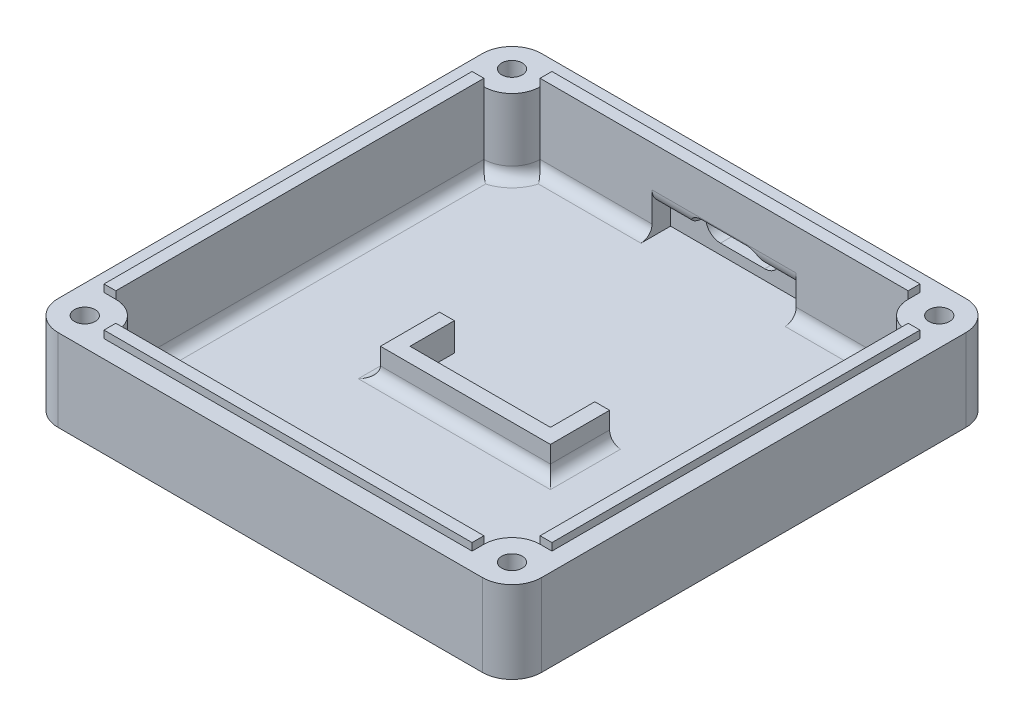
from build123d import *

# Parameters (mm, degrees)
SKETCH1_W           = 65.4
SKETCH1_H           = 65.4
BOSS_EXTRUDE1_DEPTH = 1.12
FILLET1_R           = 4
BOSS_EXTRUDE2_START = 10
BOSS_EXTRUDE2_DEPTH = 10
CUT_EXTRUDE1_REACH  = 75.96
SKETCH4_W           = 19.5
SKETCH4_H           = 3.5
CUT_EXTRUDE2_DEPTH  = 2.5
FILLET3_R           = 2
SKETCH5_W           = 1.6
SKETCH5_H           = 49.8
SKETCH5_W_2         = 49.8
SKETCH5_H_2         = 1.6
BOSS_EXTRUDE3_DEPTH = 1
BOSS_EXTRUDE4_DEPTH = 3.8
SKETCH7_R           = 1.4
CUT_EXTRUDE3_DEPTH  = 11.12
SKETCH8_R           = 2.75
CUT_EXTRUDE4_DEPTH  = 4
FILLET4_R           = 1.5
FILLET5_R           = 1.5


with BuildPart() as part:
    # Sketch1 → Boss-Extrude1 (new body)
    with BuildSketch(Plane(origin=(0, 0, 0), x_dir=(1, 0, 0), z_dir=(0, 1, 0))):
        Rectangle(SKETCH1_W, SKETCH1_H)
    extrude(amount=BOSS_EXTRUDE1_DEPTH)

    # Fillet1
    fillet1_edges = [part.edges().sort_by_distance(p)[0] for p in [
        (32.7, 0.56, 32.7),
        (-32.7, 0.56, 32.7),
        (-32.7, 0.56, -32.7),
        (32.7, 0.56, -32.7),
    ]]
    fillet(fillet1_edges, radius=FILLET1_R)

    # Sketch2 → Boss-Extrude2 (add)
    with BuildSketch(Plane(origin=(0, 1.12, 0), x_dir=(1, 0, 0), z_dir=(0, 1, 0)).offset(BOSS_EXTRUDE2_START)):
        with BuildLine():
            Line((-32.7, 28.7), (-32.7, -28.7))
            ThreePointArc((-32.7, -28.7), (-31.528427125, -31.528427125), (-28.7, -32.7))
            Line((-28.7, -32.7), (28.7, -32.7))
            ThreePointArc((28.7, -32.7), (31.528427125, -31.528427125), (32.7, -28.7))
            Line((32.7, -28.7), (32.7, 28.7))
            ThreePointArc((32.7, 28.7), (31.528427125, 31.528427125), (28.7, 32.7))
            Line((28.7, 32.7), (-28.7, 32.7))
            ThreePointArc((-28.7, 32.7), (-31.528427125, 31.528427125), (-32.7, 28.7))
        make_face()
        with BuildLine():
            Line((24.9, 28.7), (-24.9, 28.7))
            ThreePointArc((-24.9, 28.7), (-26.012994231, 26.012994231), (-28.7, 24.9))
            Line((-28.7, 24.9), (-28.7, -24.9))
            ThreePointArc((-28.7, -24.9), (-26.012994231, -26.012994231), (-24.9, -28.7))
            Line((-24.9, -28.7), (24.9, -28.7))
            ThreePointArc((24.9, -28.7), (26.012994231, -26.012994231), (28.7, -24.9))
            Line((28.7, -24.9), (28.7, 24.9))
            ThreePointArc((28.7, 24.9), (26.012994231, 26.012994231), (24.9, 28.7))
        make_face(mode=Mode.SUBTRACT)
    extrude(amount=-BOSS_EXTRUDE2_DEPTH)

    # Sketch3 → Cut-Extrude1 (cut, up to next)
    with BuildSketch(Plane(origin=(0, 0, -32.7), x_dir=(-1, 0, 0), z_dir=(0, 0, -1)), mode=Mode.PRIVATE) as cut_extrude1_sk1:
        with BuildLine():
            Line((-3, 6.5), (3, 6.5))
            ThreePointArc((3, 6.5), (5, 4.5), (3, 2.5))
            Line((3, 2.5), (-3, 2.5))
            ThreePointArc((-3, 2.5), (-5, 4.5), (-3, 6.5))
        make_face()
    cut_extrude1_tool1 = extrude(cut_extrude1_sk1.sketch, amount=-CUT_EXTRUDE1_REACH, mode=Mode.PRIVATE) & part.part
    add(cut_extrude1_tool1.solids().sort_by_distance((0, 4.5, -32.7))[0], mode=Mode.SUBTRACT)

    # Sketch4 → Cut-Extrude2 (cut)
    with BuildSketch(Plane.XY.offset(-28.7)):
        with Locations((0, 2.87)):
            Rectangle(SKETCH4_W, SKETCH4_H)
    extrude(amount=-CUT_EXTRUDE2_DEPTH, mode=Mode.SUBTRACT)

    # Fillet3
    # the kernel refuses this fillet: 2 mm, written as the material it takes off along each edge
    with BuildSketch(Plane(origin=(-0.003603246, 4.62, -28.7), x_dir=(0, 1, 0), z_dir=(1, 0, 0)), Plane(origin=(-9.75, 4.62, -28.7), x_dir=(0, 1, 0), z_dir=(1, 0, 0))) as fillet3_piece_1:
        with BuildLine():
            CenterArc((FILLET3_R, -FILLET3_R), FILLET3_R, 90, 90)
            Line((0, -FILLET3_R), (0, 0))
            Line((0, 0), (FILLET3_R, 0))
        make_face()
    extrude(amount=9.753603246, mode=Mode.SUBTRACT)

    # Sketch5 → Boss-Extrude3 (add)
    with BuildSketch(Plane(origin=(0, 11.12, 0), x_dir=(1, 0, 0), z_dir=(0, 1, 0))):
        with Locations((-29.5, 0)):
            Rectangle(SKETCH5_W, SKETCH5_H)
        with Locations((0, -29.5)):
            Rectangle(SKETCH5_W_2, SKETCH5_H_2)
        with Locations((29.5, 0)):
            Rectangle(SKETCH5_W, SKETCH5_H)
        with Locations((0, 29.5)):
            Rectangle(SKETCH5_W_2, SKETCH5_H_2)
    extrude(amount=BOSS_EXTRUDE3_DEPTH)

    # Sketch6 → Boss-Extrude4 (add)
    with BuildSketch(Plane(origin=(0, 1.12, 0), x_dir=(1, 0, 0), z_dir=(0, 1, 0))):
        Polygon((-9.5, -4.3), (9.5, -4.3), (9.5, 1.7), (11.5, 1.7), (11.5, -6.3), (-11.5, -6.3), (-11.5, 1.7), (-9.5, 1.7), align=None)
    extrude(amount=BOSS_EXTRUDE4_DEPTH)

    # Sketch7 → Cut-Extrude3 (cut)
    with BuildSketch(Plane(origin=(0, 11.12, 0), x_dir=(1, 0, 0), z_dir=(0, 1, 0))):
        with Locations(Location((-28.9, 28.9, 0), (0, 0, 270))):
            Circle(SKETCH7_R)
        with Locations(Location((28.9, 28.9, 0), (0, 0, 270))):
            Circle(SKETCH7_R)
        with Locations(Location((28.9, -28.9, 0), (0, 0, 270))):
            Circle(SKETCH7_R)
        with Locations(Location((-28.9, -28.9, 0), (0, 0, 270))):
            Circle(SKETCH7_R)
    extrude(amount=-CUT_EXTRUDE3_DEPTH, mode=Mode.SUBTRACT)

    # Sketch8 → Cut-Extrude4 (cut)
    with BuildSketch(Plane.XZ):
        with Locations(Location((-28.9, 28.9, 0), (0, 0, 270))):
            Circle(SKETCH8_R)
        with Locations(Location((28.9, 28.9, 0), (0, 0, 270))):
            Circle(SKETCH8_R)
        with Locations(Location((28.9, -28.9, 0), (0, 0, 270))):
            Circle(SKETCH8_R)
        with Locations(Location((-28.9, -28.9, 0), (0, 0, 270))):
            Circle(SKETCH8_R)
    extrude(amount=-CUT_EXTRUDE4_DEPTH, mode=Mode.SUBTRACT)

    # Fillet4
    fillet4_edges = [part.edges().sort_by_distance(p)[0] for p in [
        (-11.5, 1.12, 2.3),
        (0, 1.12, 6.3),
        (11.5, 1.12, 2.3),
    ]]
    fillet(fillet4_edges, radius=FILLET4_R)

    # Fillet5
    fillet5_edges = [part.edges().sort_by_distance(p)[0] for p in [
        (-17.325, 1.12, -28.7),
        (26.012994231, 1.12, -26.012994231),
        (17.325, 1.12, -28.7),
        (-26.012994231, 1.12, -26.012994231),
        (-28.7, 1.12, 0),
        (-26.012994231, 1.12, 26.012994231),
        (0, 1.12, 28.7),
        (26.012994231, 1.12, 26.012994231),
        (28.7, 1.12, 0),
    ]]
    fillet(fillet5_edges, radius=FILLET5_R)


solid = part.part
